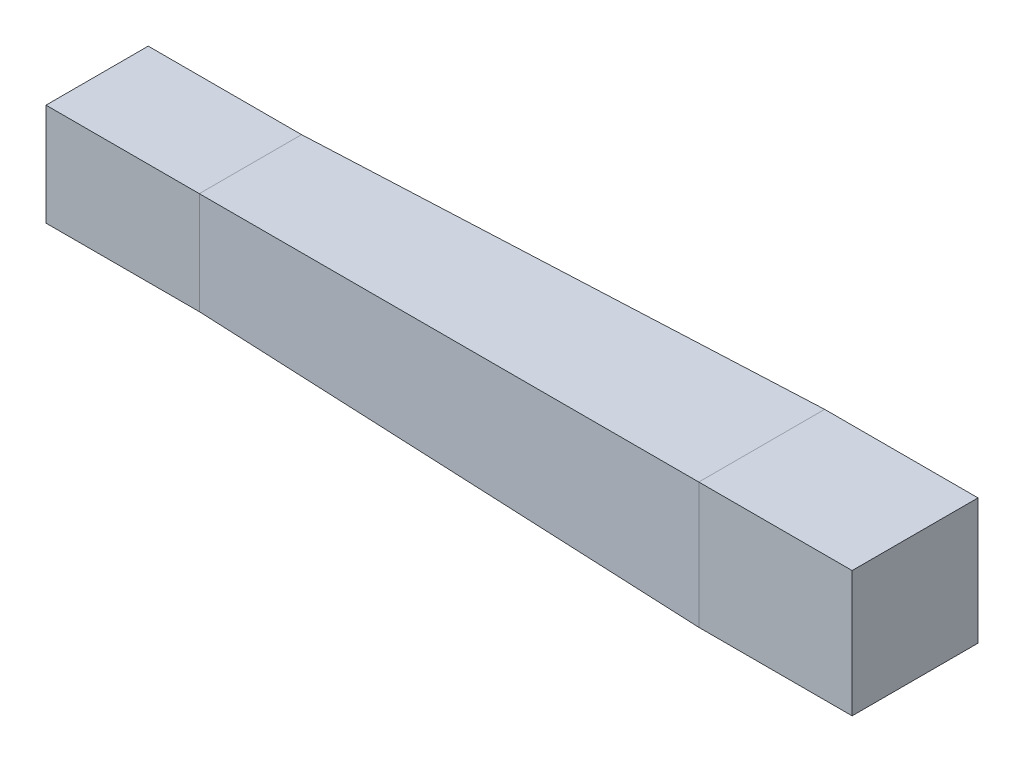
from build123d import *

# Parameters (mm, degrees)
LOFT1_OUTLINE_W     = 204.216
LOFT1_OUTLINE_H     = 204.216
LOFT1_DEPTH         = 1021.439287055
LOFT1_DRAFT         = -1.324797
SKETCH3_2_W         = 251.46
SKETCH3_2_H         = 251.46
BOSS_EXTRUDE1_DEPTH = 306.324
SKETCH2_2_W         = 204.216
SKETCH2_2_H         = 204.216
BOSS_EXTRUDE2_DEPTH = 306.324


# Read off the part's stored shape, not the designer's step: Loft1
with BuildPart() as part:
    # Loft1 outline → Loft1 (with draft: the straight prism first)
    with BuildSketch(Plane.YZ.offset(-0.580963743)):
        Rectangle(LOFT1_OUTLINE_W, LOFT1_OUTLINE_H)
    extrude(amount=LOFT1_DEPTH)
    # Loft1: the draft: its side faces are tilted about the plane it starts from
    loft1_sides = [part.faces().sort_by_distance(p)[0] for p in [
        (510.138679785, 102.108, 0),
        (510.138679785, 0, 102.108),
        (510.138679785, -102.108, 0),
        (510.138679785, 0, -102.108),
    ]]
    draft(loft1_sides, Plane.YZ.offset(-0.580963743), LOFT1_DRAFT)

    # Sketch3<2> → Boss-Extrude1 (add)
    with BuildSketch(Plane(origin=(1020.858323313, 0, 0), x_dir=(0, 0, -1), z_dir=(1, 0, 0))):
        Rectangle(SKETCH3_2_W, SKETCH3_2_H)
    extrude(amount=BOSS_EXTRUDE1_DEPTH)

    # Sketch2<2> → Boss-Extrude2 (add)
    with BuildSketch(Plane(origin=(-0.580963743, 0, 0), x_dir=(0, 0, -1), z_dir=(1, 0, 0))):
        Rectangle(SKETCH2_2_W, SKETCH2_2_H)
    extrude(amount=-BOSS_EXTRUDE2_DEPTH)


solid = part.part
